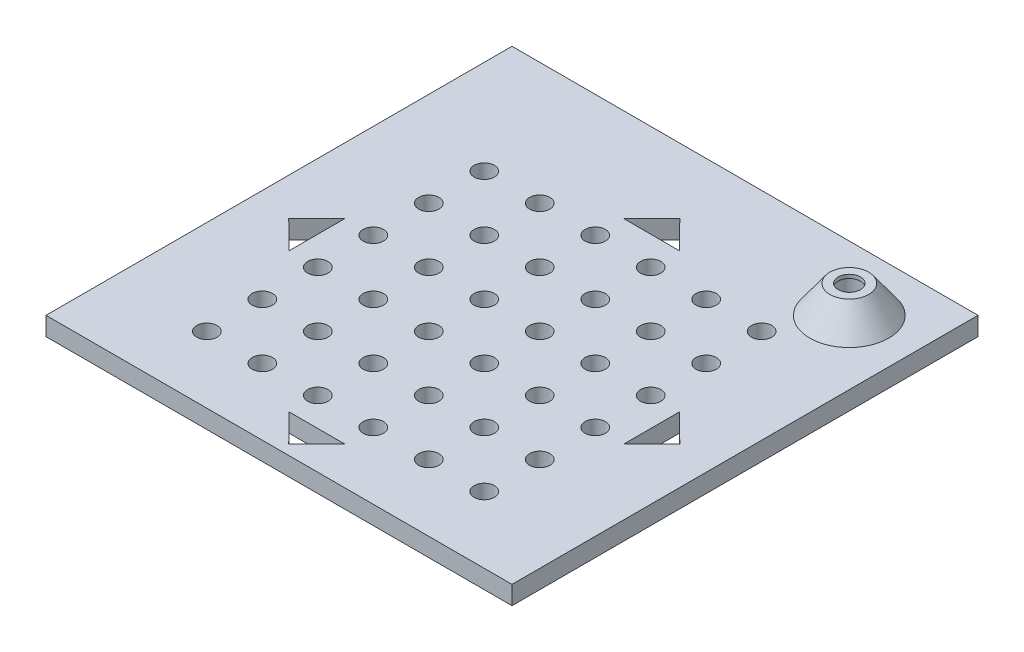
from build123d import *

# Parameters (mm, degrees)
SKETCH1_W           = 126
SKETCH1_H           = 126
BOSS_EXTRUDE1_DEPTH = 5
SKETCH3_R           = 12.5
BOSS_EXTRUDE2_DEPTH = 7.5
SKETCH4_R           = 3.45
CUT_EXTRUDE1_DEPTH  = 11.5
SKETCH6_R           = 3
CUT_EXTRUDE2_DEPTH  = 179.628805068
CHAMFER1_SIZE       = 10
CHAMFER1_SIZE_2     = 7.26542528
SKETCH7_R           = 2.75
CUT_EXTRUDE3_DEPTH  = 179.348675353
CUT_EXTRUDE4_DEPTH  = 179.348675353


with BuildPart() as part:
    # Sketch1 → Boss-Extrude1 (new body)
    with BuildSketch(Plane(origin=(0, 0, 0), x_dir=(1, 0, 0), z_dir=(0, 1, 0))):
        with Locations((63, 63)):
            Rectangle(SKETCH1_W, SKETCH1_H)
    extrude(amount=BOSS_EXTRUDE1_DEPTH)

    # Sketch3 → Boss-Extrude2 (add)
    with BuildSketch(Plane(origin=(0, 5, 0), x_dir=(1, 0, 0), z_dir=(0, 1, 0))):
        with Locations(Location((108.6, 108.6, 0), (0, 0, 90))):
            Circle(SKETCH3_R)
    extrude(amount=BOSS_EXTRUDE2_DEPTH)

    # Sketch4 → Cut-Extrude1 (cut)
    with BuildSketch(Plane.XZ):
        with Locations(Location((108.6, -108.6, 0), (0, 0, 270))):
            Circle(SKETCH4_R)
    extrude(amount=-CUT_EXTRUDE1_DEPTH, mode=Mode.SUBTRACT)

    # Sketch6 → Cut-Extrude2 (cut, through all)
    with BuildSketch(Plane(origin=(0, 12.5, 0), x_dir=(1, 0, 0), z_dir=(0, 1, 0))):
        with Locations(Location((108.6, 108.6, 0), (0, 0, 270))):
            Circle(SKETCH6_R)
    extrude(amount=-CUT_EXTRUDE2_DEPTH, mode=Mode.SUBTRACT)

    # Chamfer1
    # the kernel refuses this chamfer: 10, 7.26542528 mm, written as the material it takes off along each edge
    with BuildSketch(Plane(origin=(108.6, 12.5, -108.6), x_dir=(0, 0, -1), z_dir=(1, 0, 0))) as chamfer1_piece_1_section:
        Polygon((12.5, -CHAMFER1_SIZE), (12.5 - CHAMFER1_SIZE_2, 0), (12.5, 0), align=None)
    chamfer1_piece_1 = revolve(axis=Axis((108.6, 12.5, -108.6), (0, 1, 0)), mode=Mode.PRIVATE)
    chamfer1_piece_1 = split(chamfer1_piece_1, bisect_by=Plane(origin=(108.6, 5, -108.6), z_dir=(0, 1, 0)), keep=Keep.TOP, mode=Mode.PRIVATE)
    add(chamfer1_piece_1, mode=Mode.SUBTRACT)

    # Sketch7 → Cut-Extrude3 (cut, through all)
    with BuildSketch(Plane(origin=(0, 5, 0), x_dir=(1, 0, 0), z_dir=(0, 1, 0))):
        with Locations(Location((55.5, 63, 0), (0, 0, 270))):
            Circle(SKETCH7_R)
        with Locations(Location((70.5, 63, 0), (0, 0, 270))):
            Circle(SKETCH7_R)
        with Locations(Location((40.5, 63, 0), (0, 0, 270))):
            Circle(SKETCH7_R)
        with Locations(Location((85.5, 63, 0), (0, 0, 270))):
            Circle(SKETCH7_R)
        with Locations(Location((25.5, 63, 0), (0, 0, 270))):
            Circle(SKETCH7_R)
        with Locations(Location((100.5, 63, 0), (0, 0, 270))):
            Circle(SKETCH7_R)
        with Locations(Location((25.5, 48, 0), (0, 0, 270))):
            Circle(SKETCH7_R)
        with Locations(Location((40.5, 48, 0), (0, 0, 270))):
            Circle(SKETCH7_R)
        with Locations(Location((55.5, 48, 0), (0, 0, 270))):
            Circle(SKETCH7_R)
        with Locations(Location((70.5, 48, 0), (0, 0, 270))):
            Circle(SKETCH7_R)
        with Locations(Location((85.5, 48, 0), (0, 0, 270))):
            Circle(SKETCH7_R)
        with Locations(Location((100.5, 48, 0), (0, 0, 270))):
            Circle(SKETCH7_R)
        with Locations(Location((25.5, 33, 0), (0, 0, 270))):
            Circle(SKETCH7_R)
        with Locations(Location((40.5, 33, 0), (0, 0, 270))):
            Circle(SKETCH7_R)
        with Locations(Location((55.5, 33, 0), (0, 0, 270))):
            Circle(SKETCH7_R)
        with Locations(Location((70.5, 33, 0), (0, 0, 270))):
            Circle(SKETCH7_R)
        with Locations(Location((85.5, 33, 0), (0, 0, 270))):
            Circle(SKETCH7_R)
        with Locations(Location((100.5, 33, 0), (0, 0, 270))):
            Circle(SKETCH7_R)
        with Locations(Location((25.5, 18, 0), (0, 0, 270))):
            Circle(SKETCH7_R)
        with Locations(Location((40.5, 18, 0), (0, 0, 270))):
            Circle(SKETCH7_R)
        with Locations(Location((55.5, 18, 0), (0, 0, 270))):
            Circle(SKETCH7_R)
        with Locations(Location((70.5, 18, 0), (0, 0, 270))):
            Circle(SKETCH7_R)
        with Locations(Location((85.5, 18, 0), (0, 0, 270))):
            Circle(SKETCH7_R)
        with Locations(Location((100.5, 18, 0), (0, 0, 270))):
            Circle(SKETCH7_R)
        with Locations(Location((25.5, 78, 0), (0, 0, 270))):
            Circle(SKETCH7_R)
        with Locations(Location((40.5, 78, 0), (0, 0, 270))):
            Circle(SKETCH7_R)
        with Locations(Location((55.5, 78, 0), (0, 0, 270))):
            Circle(SKETCH7_R)
        with Locations(Location((70.5, 78, 0), (0, 0, 270))):
            Circle(SKETCH7_R)
        with Locations(Location((85.5, 78, 0), (0, 0, 270))):
            Circle(SKETCH7_R)
        with Locations(Location((100.5, 78, 0), (0, 0, 270))):
            Circle(SKETCH7_R)
        with Locations(Location((25.5, 93, 0), (0, 0, 270))):
            Circle(SKETCH7_R)
        with Locations(Location((40.5, 93, 0), (0, 0, 270))):
            Circle(SKETCH7_R)
        with Locations(Location((55.5, 93, 0), (0, 0, 270))):
            Circle(SKETCH7_R)
        with Locations(Location((70.5, 93, 0), (0, 0, 270))):
            Circle(SKETCH7_R)
        with Locations(Location((85.5, 93, 0), (0, 0, 270))):
            Circle(SKETCH7_R)
        with Locations(Location((100.5, 93, 0), (0, 0, 270))):
            Circle(SKETCH7_R)
    extrude(amount=-CUT_EXTRUDE3_DEPTH, mode=Mode.SUBTRACT)

    # Sketch8 → Cut-Extrude4 (cut, through all)
    with BuildSketch(Plane(origin=(0, 5, 0), x_dir=(1, 0, 0), z_dir=(0, 1, 0))):
        Polygon((70.5, 100.75), (63, 108.375), (55.5, 100.75), align=None)
        Polygon((108.25, 63), (115.875, 55.5), (108.25, 48), align=None)
        Polygon((55.5, 10.25), (63, 2.625), (70.5, 10.25), align=None)
        Polygon((17.75, 63), (17.75, 48), (10.125, 55.5), align=None)
    extrude(amount=-CUT_EXTRUDE4_DEPTH, mode=Mode.SUBTRACT)


solid = part.part
